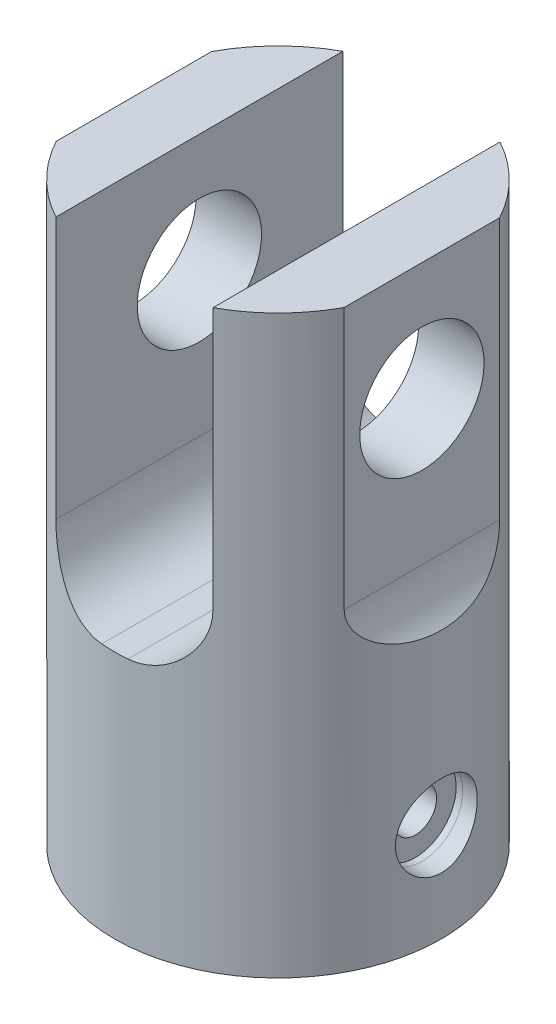
from build123d import *

# Parameters (mm, degrees)
SKETCH1_R                           = 25
SKETCH1_R_2                         = 15.5
BOSS_EXTRUDE1_DEPTH                 = 30
SKETCH3_R                           = 25
BOSS_EXTRUDE2_DEPTH                 = 8
BOSS_EXTRUDE3_DEPTH                 = 50
CUT_EXTRUDE1_DEPTH                  = 103.849404471
CUT_EXTRUDE1_DEPTH_BACK             = 103.849404471
SKETCH6_R                           = 9.5
FILLET2_R                           = 10
CUT_EXTRUDE2_REACH                  = 104.849
CUT_EXTRUDE2_END_RADIUS             = 25
SKETCH7_R                           = 8.25
CUT_EXTRUDE2_DIRECTION_2_REACH      = 104.849
CUT_EXTRUDE2_DIRECTION_2_END_RADIUS = 15.5
SKETCH8_R                           = 6.25
CUT_EXTRUDE3_DEPTH                  = 103.849404626
CUT_EXTRUDE3_OTHER_WAY_DEPTH        = 1
CUT_EXTRUDE3_OTHER_WAY_TAPER        = 1
CUT_EXTRUDE4_REACH                  = 104.396
CUT_EXTRUDE4_END_RADIUS             = 15.5
SKETCH9_R                           = 3.25


with BuildPart() as part:
    # Sketch1 → Boss-Extrude1 (new body)
    with BuildSketch(Plane(origin=(0, 0, 0), x_dir=(1, 0, 0), z_dir=(0, 1, 0))):
        with Locations(Location((0, 0, 0), (0, 0, 270))):
            Circle(SKETCH1_R)
        with Locations(Location((0, 0, 0), (0, 0, 270))):
            Circle(SKETCH1_R_2, mode=Mode.SUBTRACT)
    extrude(amount=BOSS_EXTRUDE1_DEPTH)

    # Sketch3 → Boss-Extrude2 (add)
    with BuildSketch(Plane(origin=(0, 30, 0), x_dir=(1, 0, 0), z_dir=(0, 1, 0))):
        with Locations(Location((0, 0, 0), (0, 0, 270))):
            Circle(SKETCH3_R)
    extrude(amount=BOSS_EXTRUDE2_DEPTH)

    # Sketch4 → Boss-Extrude3 (add)
    with BuildSketch(Plane(origin=(0, 38, 0), x_dir=(1, 0, 0), z_dir=(0, 1, 0))):
        with BuildLine():
            Line((-12, -21.931712199), (-12, 21.931712199))
            ThreePointArc((-12, 21.931712199), (-17.728160463, 17.627033971), (-22, 11.874342087))
            Line((-22, 11.874342087), (-22, -11.874342087))
            ThreePointArc((-22, -11.874342087), (-17.728160463, -17.627033971), (-12, -21.931712199))
        make_face()
        with BuildLine():
            ThreePointArc((22, 11.874342087), (17.728160463, 17.627033971), (12, 21.931712199))
            Line((12, 21.931712199), (12, -21.931712199))
            ThreePointArc((12, -21.931712199), (17.728160463, -17.627033971), (22, -11.874342087))
            Line((22, -11.874342087), (22, 11.874342087))
        make_face()
    extrude(amount=BOSS_EXTRUDE3_DEPTH)

    # Sketch6 → Cut-Extrude1 (cut, two sides: drawn at the far end of the back side and taken through both)
    with BuildSketch(Plane.ZY.offset(22).offset(-CUT_EXTRUDE1_DEPTH_BACK)):
        with Locations(Location((0, 70, 0), (0, 0, 180))):
            Circle(SKETCH6_R)
    extrude(amount=CUT_EXTRUDE1_DEPTH + CUT_EXTRUDE1_DEPTH_BACK, mode=Mode.SUBTRACT)

    # Fillet2
    # the kernel refuses this fillet: 10 mm, written as the material it adds along each edge
    with BuildSketch(Plane(origin=(-22, 38, -36.874342087), x_dir=(-1, 0, 0), z_dir=(0, 0, 1))) as fillet2_piece_1_section:
        with BuildLine():
            CenterArc((FILLET2_R, -FILLET2_R), FILLET2_R, 90, 90)
            Line((0, -FILLET2_R), (0, 0))
            Line((0, 0), (FILLET2_R, 0))
        make_face()
    fillet2_piece_1 = extrude(amount=73.748684174, mode=Mode.PRIVATE)
    fillet2_piece_1 = fillet2_piece_1 & Plane(origin=(0, 41.226834709, 0), x_dir=(0, 0, 1), z_dir=(0, -1, 0)) * Cylinder(25, 188, mode=Mode.PRIVATE)
    add(fillet2_piece_1)
    with BuildSketch(Plane(origin=(-12, 38, 46.931712199), x_dir=(1, 0, 0), z_dir=(0, 0, -1))) as fillet2_piece_2_section:
        with BuildLine():
            CenterArc((FILLET2_R, -FILLET2_R), FILLET2_R, 90, 90)
            Line((0, -FILLET2_R), (0, 0))
            Line((0, 0), (FILLET2_R, 0))
        make_face()
    fillet2_piece_2 = extrude(amount=93.863424399, mode=Mode.PRIVATE)
    fillet2_piece_2 = fillet2_piece_2 & Plane(origin=(0, 40.21683264, 0), x_dir=(0, 0, 1), z_dir=(0, -1, 0)) * Cylinder(25, 228, mode=Mode.PRIVATE)
    add(fillet2_piece_2)
    with BuildSketch(Plane(origin=(12, 38, -46.931712199), x_dir=(-1, 0, 0), z_dir=(0, 0, 1))) as fillet2_piece_3_section:
        with BuildLine():
            CenterArc((FILLET2_R, -FILLET2_R), FILLET2_R, 90, 90)
            Line((0, -FILLET2_R), (0, 0))
            Line((0, 0), (FILLET2_R, 0))
        make_face()
    fillet2_piece_3 = extrude(amount=93.863424399, mode=Mode.PRIVATE)
    fillet2_piece_3 = fillet2_piece_3 & Plane(origin=(0, 40.21683264, 0), x_dir=(0, 0, 1), z_dir=(0, -1, 0)) * Cylinder(25, 228, mode=Mode.PRIVATE)
    add(fillet2_piece_3)
    with BuildSketch(Plane(origin=(22, 38, 36.874342087), x_dir=(0, 1, 0), z_dir=(0, 0, -1))) as fillet2_piece_4_section:
        with BuildLine():
            CenterArc((FILLET2_R, FILLET2_R), FILLET2_R, 180, 90)
            Line((0, FILLET2_R), (0, 0))
            Line((0, 0), (FILLET2_R, 0))
        make_face()
    fillet2_piece_4 = extrude(amount=73.748684174, mode=Mode.PRIVATE)
    fillet2_piece_4 = fillet2_piece_4 & Plane(origin=(0, 41.226834878, 0), x_dir=(0, 0, 1), z_dir=(0, -1, 0)) * Cylinder(25, 188, mode=Mode.PRIVATE)
    add(fillet2_piece_4)

    # Cut-Extrude2: up to this cylinder (the profile starts inside it)
    cut_extrude2_end = Plane(origin=(0, 15, 0), z_dir=(0, -1, 0)) * Cylinder(CUT_EXTRUDE2_END_RADIUS, 260.698, mode=Mode.PRIVATE)
    # Sketch7 → Cut-Extrude2 (cut, up to the surface)
    with BuildSketch(Plane.ZY.offset(22), mode=Mode.PRIVATE) as cut_extrude2_sk1:
        with Locations((0, 15)):
            Circle(SKETCH7_R)
    cut_extrude2_tool1 = extrude(cut_extrude2_sk1.sketch, amount=CUT_EXTRUDE2_REACH, mode=Mode.PRIVATE) & cut_extrude2_end
    add(cut_extrude2_tool1.solids().sort_by_distance((-22, 15, 0))[0], mode=Mode.SUBTRACT)

    # Cut-Extrude2 direction 2: up to this cylinder (the profile starts outside it)
    cut_extrude2_direction_2_end = Plane(origin=(0, 15, 0), z_dir=(0, -1, 0)) * Cylinder(CUT_EXTRUDE2_DIRECTION_2_END_RADIUS, 241.698, mode=Mode.PRIVATE)
    # Sketch7 → Cut-Extrude2 direction 2 (cut, up to the surface)
    with BuildSketch(Plane.ZY.offset(22), mode=Mode.PRIVATE) as cut_extrude2_direction_2_sk1:
        with Locations((0, 15)):
            Circle(SKETCH7_R)
    cut_extrude2_direction_2_tool1 = extrude(cut_extrude2_direction_2_sk1.sketch, amount=-CUT_EXTRUDE2_DIRECTION_2_REACH, mode=Mode.PRIVATE) - cut_extrude2_direction_2_end
    add(cut_extrude2_direction_2_tool1.solids().sort_by_distance((-22, 15, 0))[0], mode=Mode.SUBTRACT)

    # Sketch8 → Cut-Extrude3 (cut)
    with BuildSketch(Plane(origin=(22, 0, 0), x_dir=(0, 0, -1), z_dir=(1, 0, 0))):
        with Locations(Location((0, 15, 0), (0, 0, 270))):
            Circle(SKETCH8_R)
    extrude(amount=CUT_EXTRUDE3_DEPTH, mode=Mode.SUBTRACT)

    # Sketch8 → Cut-Extrude3 other way (cut)
    with BuildSketch(Plane(origin=(22, 0, 0), x_dir=(0, 0, -1), z_dir=(1, 0, 0))):
        with Locations(Location((0, 15, 0), (0, 0, 270))):
            Circle(SKETCH8_R)
    extrude(amount=-CUT_EXTRUDE3_OTHER_WAY_DEPTH, taper=CUT_EXTRUDE3_OTHER_WAY_TAPER, mode=Mode.SUBTRACT)

    # Cut-Extrude4: up to this cylinder (the profile starts outside it)
    cut_extrude4_end = Plane(origin=(0, 15, 0), z_dir=(0, -1, 0)) * Cylinder(CUT_EXTRUDE4_END_RADIUS, 240.792, mode=Mode.PRIVATE)
    # Sketch9 → Cut-Extrude4 (cut, up to the surface)
    with BuildSketch(Plane(origin=(21, 0, 0), x_dir=(0, 0, -1), z_dir=(1, 0, 0)), mode=Mode.PRIVATE) as cut_extrude4_sk1:
        with Locations((0, 15)):
            Circle(SKETCH9_R)
    cut_extrude4_tool1 = extrude(cut_extrude4_sk1.sketch, amount=-CUT_EXTRUDE4_REACH, mode=Mode.PRIVATE) - cut_extrude4_end
    add(cut_extrude4_tool1.solids().sort_by_distance((21, 15, 0))[0], mode=Mode.SUBTRACT)


solid = part.part
